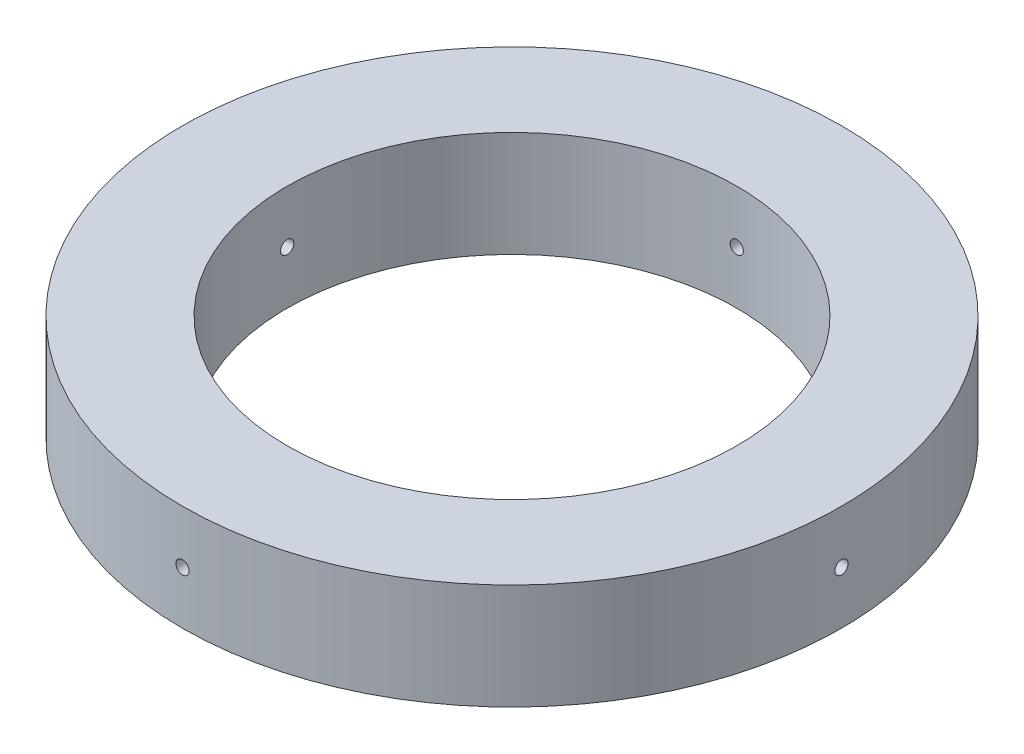
from build123d import *

# Parameters (mm, degrees)
CROQUIS1_R                 = 62.36
CROQUIS1_R_2               = 42.55
SALIENTE_EXTRUIR1_DEPTH    = 20
CORTAR_EXTRUIR1_REACH      = 92.43
CORTAR_EXTRUIR1_END_RADIUS = 62.36
CROQUIS2_R                 = 1.25
MATRIZC1_COUNT             = 4


with BuildPart() as part:
    # Croquis1 → Saliente-Extruir1 (new body)
    with BuildSketch(Plane(origin=(0, 0, 0), x_dir=(1, 0, 0), z_dir=(0, 1, 0))):
        Circle(CROQUIS1_R)
        Circle(CROQUIS1_R_2, mode=Mode.SUBTRACT)
    extrude(amount=SALIENTE_EXTRUIR1_DEPTH)

    # Cortar-Extruir1: up to this cylinder (the profile starts inside it)
    cortar_extruir1_end = Plane(origin=(0, 10, 0), z_dir=(0, -1, 0)) * Cylinder(CORTAR_EXTRUIR1_END_RADIUS, 310.58, mode=Mode.PRIVATE)
    # Croquis2 → Cortar-Extruir1 (cut, up to the surface)
    with BuildSketch(Plane.XY, mode=Mode.PRIVATE) as cortar_extruir1_sk1:
        with Locations((0, 10)):
            Circle(CROQUIS2_R)
    cortar_extruir1_tool1 = extrude(cortar_extruir1_sk1.sketch, amount=-CORTAR_EXTRUIR1_REACH, mode=Mode.PRIVATE) & cortar_extruir1_end
    cortar_extruir1 = cortar_extruir1_tool1.solids().sort_by_distance((0, 10, 0))[0]
    add(cortar_extruir1, mode=Mode.SUBTRACT)

    # MatrizC1: Cortar-Extruir1 ×4 about axis
    matrizc1_axis = Axis((0, 20, 0), (0, 1, 0))
    for i in range(1, MATRIZC1_COUNT):
        add(cortar_extruir1.rotate(matrizc1_axis, i * 360 / MATRIZC1_COUNT), mode=Mode.SUBTRACT)


solid = part.part
